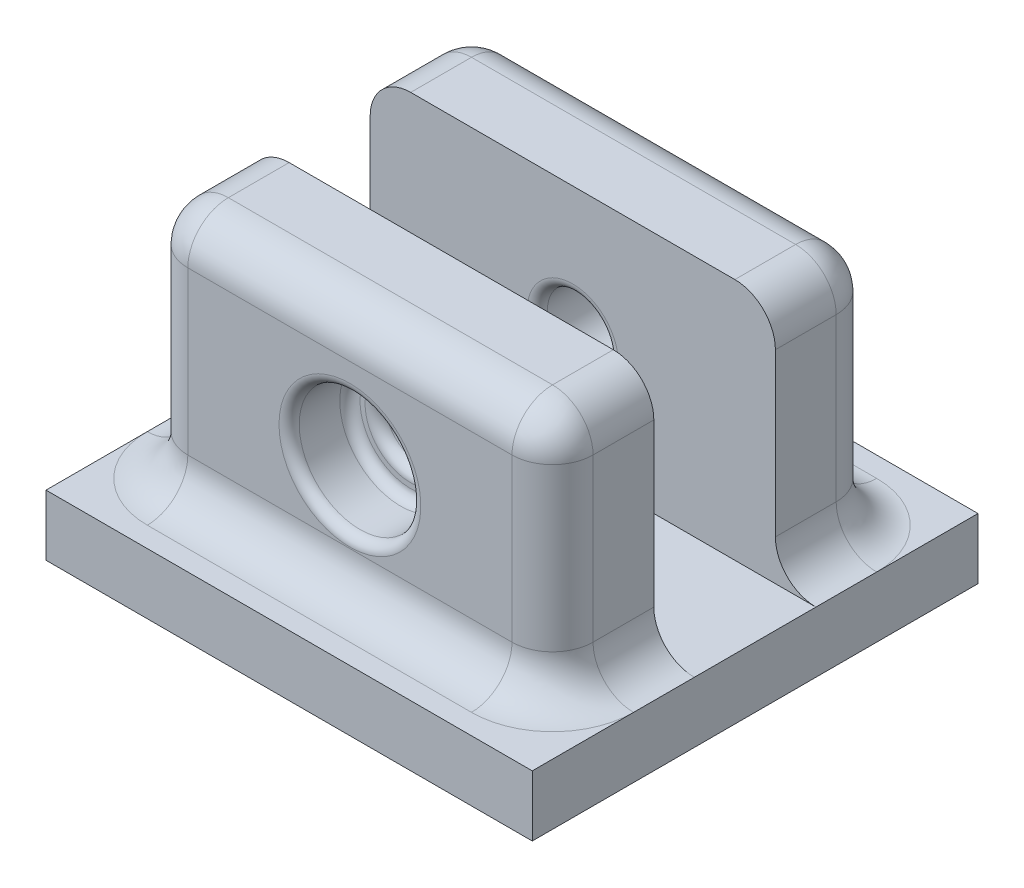
from build123d import *

# Parameters (mm, degrees)
SKETCH1_W             = 20
SKETCH1_H             = 5
BOSS_EXTRUDE1_DEPTH   = 15
BOSS_EXTRUDE1_2_DEPTH = 15
SKETCH2_R             = 1.75
CUT_EXTRUDE1_DEPTH    = 19
SKETCH2_3_R           = 3
SKETCH2_3_R_2         = 1.75
CUT_EXTRUDE2_DEPTH    = 3
SKETCH1_3_W           = 24
SKETCH1_3_H           = 22
SKETCH1_3_W_2         = 20
SKETCH1_3_H_2         = 5
BOSS_EXTRUDE2_DEPTH   = 3
FILLET1_R             = 2
FILLET2_R             = 0.5


with BuildPart() as part:
    # Sketch1 → Boss-Extrude1 (new body)
    with BuildSketch(Plane(origin=(0, 0, 0), x_dir=(1, 0, 0), z_dir=(0, 1, 0))):
        with Locations((9.931745104, -5.5)):
            Rectangle(SKETCH1_W, SKETCH1_H)
    extrude(amount=BOSS_EXTRUDE1_DEPTH)


with BuildPart() as body_2:
    # Sketch1 → Boss-Extrude1 2 (new body)
    with BuildSketch(Plane(origin=(0, 0, 0), x_dir=(1, 0, 0), z_dir=(0, 1, 0))):
        with Locations((9.931745104, 5.5)):
            Rectangle(SKETCH1_W, SKETCH1_H)
    extrude(amount=BOSS_EXTRUDE1_2_DEPTH)


with BuildPart() as cut_extrude1_tool:
    # Sketch2 → Cut-Extrude1 (new body)
    with BuildSketch(Plane.XY.offset(8)):
        with Locations(Location((9.931745104, 8.562679124, 0), (0, 0, 180))):
            Circle(SKETCH2_R)
    extrude(amount=-CUT_EXTRUDE1_DEPTH)


with BuildPart() as part_1:
    add(part.part)

    # Cut-Extrude1: cut by cut_extrude1_tool
    add(cut_extrude1_tool.part, mode=Mode.SUBTRACT)

    # Sketch2<3> → Cut-Extrude2 (cut)
    with BuildSketch(Plane.XY.offset(8)):
        with Locations((9.931745104, 8.562679124)):
            Circle(SKETCH2_3_R)
        with Locations(Location((9.931745104, 8.562679124, 0), (0, 0, 180))):
            Circle(SKETCH2_3_R_2, mode=Mode.SUBTRACT)
    extrude(amount=-CUT_EXTRUDE2_DEPTH, mode=Mode.SUBTRACT)



with BuildPart() as body_2_1:
    add(body_2.part)

    # Cut-Extrude1: cut by cut_extrude1_tool
    add(cut_extrude1_tool.part, mode=Mode.SUBTRACT)


with BuildPart() as part_2:
    add(part_1.part)

    add(body_2_1.part)  # Boss-Extrude2 merges body 2
    # Sketch1<3> → Boss-Extrude2 (add)
    with BuildSketch(Plane(origin=(0, 0, 0), x_dir=(1, 0, 0), z_dir=(0, 1, 0))):
        with Locations((9.931745104, 0)):
            Rectangle(SKETCH1_3_W, SKETCH1_3_H)
        with Locations((9.931745104, -5.5)):
            Rectangle(SKETCH1_3_W_2, SKETCH1_3_H_2, mode=Mode.SUBTRACT)
        with Locations((9.931745104, 5.5)):
            Rectangle(SKETCH1_3_W_2, SKETCH1_3_H_2, mode=Mode.SUBTRACT)
    extrude(amount=BOSS_EXTRUDE2_DEPTH)

    # Fillet1
    fillet1_edges = [part_2.edges().sort_by_distance(p)[0] for p in [
        (19.931745104, 15, -5.5),
        (19.931745104, 3, 5.5),
        (-0.068254896, 3, 5.5),
        (9.931745104, 3, 8),
        (-0.068254896, 3, -5.5),
        (19.931745104, 3, -5.5),
        (9.931745104, 3, -8),
        (9.931745104, 15, -8),
        (-0.068254896, 9, 8),
        (19.931745104, 9, 8),
        (-0.068254896, 15, 5.5),
        (9.931745104, 15, 8),
        (19.931745104, 15, 5.5),
        (-0.068254896, 15, -5.5),
        (19.931745104, 9, -8),
        (-0.068254896, 9, -8),
    ]]
    fillet(fillet1_edges, radius=FILLET1_R - 0.0001)  # a hair under: the kernel refuses the full size

    # Fillet2
    fillet2_edges = [part_2.edges().sort_by_distance(p)[0] for p in [
        (11.681745104, 8.562679124, -8),
        (11.681745104, 8.562679124, -3),
        (11.681745104, 8.562679124, 3),
        (11.681745104, 8.562679124, 5),
        (6.931745104, 8.562679124, 8),
        (6.931745104, 8.562679124, 5),
    ]]
    fillet(fillet2_edges, radius=FILLET2_R)


solid = part_2.part
